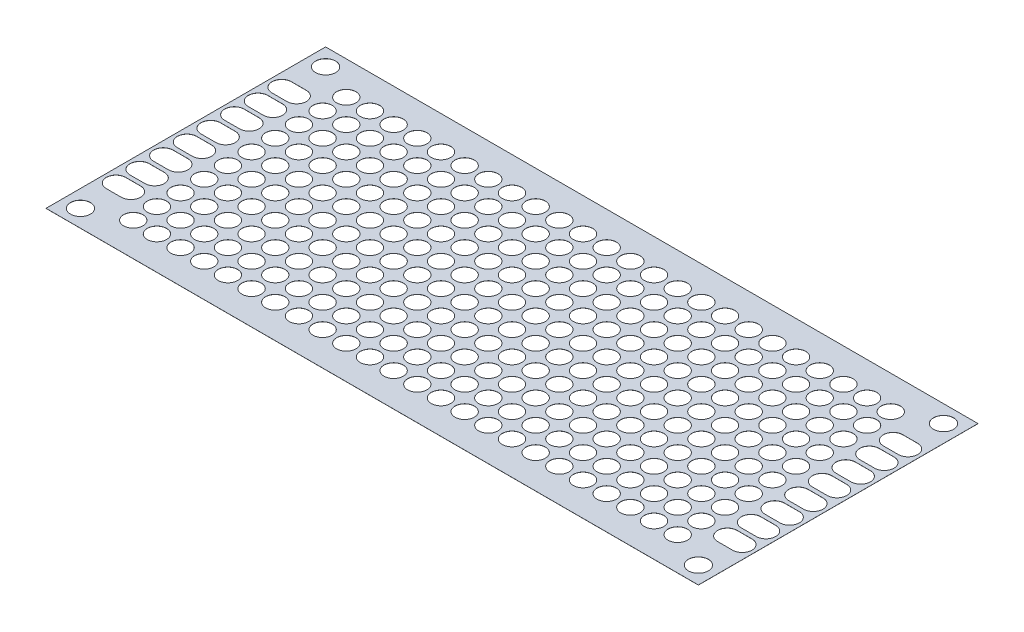
from build123d import *

# Parameters (mm, degrees)
SKETCH1_W           = 70
SKETCH1_H           = 30
BOSS_EXTRUDE1_DEPTH = 0.01
SKETCH2_R           = 1.0375
SKETCH2_R_2         = 1.074207477
CUT_EXTRUDE1_DEPTH  = 39.078866842


with BuildPart() as part:
    # Sketch1 → Boss-Extrude1 (new body)
    with BuildSketch(Plane(origin=(0, 0, 0), x_dir=(1, 0, 0), z_dir=(0, 1, 0))):
        Rectangle(SKETCH1_W, SKETCH1_H)
    extrude(amount=BOSS_EXTRUDE1_DEPTH)

    # Sketch2 → Cut-Extrude1 (cut, through all)
    with BuildSketch(Plane(origin=(0, 0.01, 0), x_dir=(1, 0, 0), z_dir=(0, 1, 0))):
        with Locations((-29.21, -11.43)):
            Circle(SKETCH2_R)
        with Locations((-26.67, -11.43)):
            Circle(SKETCH2_R)
        with Locations((-24.13, -11.43)):
            Circle(SKETCH2_R)
        with Locations((-21.59, -11.43)):
            Circle(SKETCH2_R)
        with Locations((-19.05, -11.43)):
            Circle(SKETCH2_R)
        with Locations((-16.51, -11.43)):
            Circle(SKETCH2_R)
        with Locations((-13.97, -11.43)):
            Circle(SKETCH2_R)
        with Locations((-11.43, -11.43)):
            Circle(SKETCH2_R)
        with Locations((-8.89, -11.43)):
            Circle(SKETCH2_R)
        with Locations((-6.35, -11.43)):
            Circle(SKETCH2_R)
        with Locations((-3.81, -11.43)):
            Circle(SKETCH2_R)
        with Locations((-1.27, -11.43)):
            Circle(SKETCH2_R)
        with Locations((1.27, -11.43)):
            Circle(SKETCH2_R)
        with Locations((3.81, -11.43)):
            Circle(SKETCH2_R)
        with Locations((6.35, -11.43)):
            Circle(SKETCH2_R)
        with Locations((8.89, -11.43)):
            Circle(SKETCH2_R)
        with Locations((11.43, -11.43)):
            Circle(SKETCH2_R)
        with Locations((13.97, -11.43)):
            Circle(SKETCH2_R)
        with Locations((16.51, -11.43)):
            Circle(SKETCH2_R)
        with Locations((19.05, -11.43)):
            Circle(SKETCH2_R)
        with Locations((21.59, -11.43)):
            Circle(SKETCH2_R)
        with Locations((24.13, -11.43)):
            Circle(SKETCH2_R)
        with Locations((26.67, -11.43)):
            Circle(SKETCH2_R)
        with Locations((29.21, -11.43)):
            Circle(SKETCH2_R)
        with Locations((-29.21, -8.89)):
            Circle(SKETCH2_R)
        with Locations((-26.67, -8.89)):
            Circle(SKETCH2_R)
        with Locations((-24.13, -8.89)):
            Circle(SKETCH2_R)
        with Locations((-21.59, -8.89)):
            Circle(SKETCH2_R)
        with Locations((-19.05, -8.89)):
            Circle(SKETCH2_R)
        with Locations((-16.51, -8.89)):
            Circle(SKETCH2_R)
        with Locations((-13.97, -8.89)):
            Circle(SKETCH2_R)
        with Locations((-11.43, -8.89)):
            Circle(SKETCH2_R)
        with Locations((-8.89, -8.89)):
            Circle(SKETCH2_R)
        with Locations((-6.35, -8.89)):
            Circle(SKETCH2_R)
        with Locations((-3.81, -8.89)):
            Circle(SKETCH2_R)
        with Locations((-1.27, -8.89)):
            Circle(SKETCH2_R)
        with Locations((1.27, -8.89)):
            Circle(SKETCH2_R)
        with Locations((3.81, -8.89)):
            Circle(SKETCH2_R)
        with Locations((6.35, -8.89)):
            Circle(SKETCH2_R)
        with Locations((8.89, -8.89)):
            Circle(SKETCH2_R)
        with Locations((11.43, -8.89)):
            Circle(SKETCH2_R)
        with Locations((13.97, -8.89)):
            Circle(SKETCH2_R)
        with Locations((16.51, -8.89)):
            Circle(SKETCH2_R)
        with Locations((19.05, -8.89)):
            Circle(SKETCH2_R)
        with Locations((21.59, -8.89)):
            Circle(SKETCH2_R)
        with Locations((24.13, -8.89)):
            Circle(SKETCH2_R)
        with Locations((26.67, -8.89)):
            Circle(SKETCH2_R)
        with Locations((29.21, -8.89)):
            Circle(SKETCH2_R)
        with Locations((-29.21, -6.35)):
            Circle(SKETCH2_R)
        with Locations((-26.67, -6.35)):
            Circle(SKETCH2_R)
        with Locations((-24.13, -6.35)):
            Circle(SKETCH2_R)
        with Locations((-21.59, -6.35)):
            Circle(SKETCH2_R)
        with Locations((-19.05, -6.35)):
            Circle(SKETCH2_R)
        with Locations((-16.51, -6.35)):
            Circle(SKETCH2_R)
        with Locations((-13.97, -6.35)):
            Circle(SKETCH2_R)
        with Locations((-11.43, -6.35)):
            Circle(SKETCH2_R)
        with Locations((-8.89, -6.35)):
            Circle(SKETCH2_R)
        with Locations((-6.35, -6.35)):
            Circle(SKETCH2_R)
        with Locations((-3.81, -6.35)):
            Circle(SKETCH2_R)
        with Locations((-1.27, -6.35)):
            Circle(SKETCH2_R)
        with Locations((1.27, -6.35)):
            Circle(SKETCH2_R)
        with Locations((3.81, -6.35)):
            Circle(SKETCH2_R)
        with Locations((6.35, -6.35)):
            Circle(SKETCH2_R)
        with Locations((8.89, -6.35)):
            Circle(SKETCH2_R)
        with Locations((11.43, -6.35)):
            Circle(SKETCH2_R)
        with Locations((13.97, -6.35)):
            Circle(SKETCH2_R)
        with Locations((16.51, -6.35)):
            Circle(SKETCH2_R)
        with Locations((19.05, -6.35)):
            Circle(SKETCH2_R)
        with Locations((21.59, -6.35)):
            Circle(SKETCH2_R)
        with Locations((24.13, -6.35)):
            Circle(SKETCH2_R)
        with Locations((26.67, -6.35)):
            Circle(SKETCH2_R)
        with Locations((29.21, -6.35)):
            Circle(SKETCH2_R)
        with Locations((-29.21, -3.81)):
            Circle(SKETCH2_R)
        with Locations((-26.67, -3.81)):
            Circle(SKETCH2_R)
        with Locations((-24.13, -3.81)):
            Circle(SKETCH2_R)
        with Locations((-21.59, -3.81)):
            Circle(SKETCH2_R)
        with Locations((-19.05, -3.81)):
            Circle(SKETCH2_R)
        with Locations((-16.51, -3.81)):
            Circle(SKETCH2_R)
        with Locations((-13.97, -3.81)):
            Circle(SKETCH2_R)
        with Locations((-11.43, -3.81)):
            Circle(SKETCH2_R)
        with Locations((-8.89, -3.81)):
            Circle(SKETCH2_R)
        with Locations((-6.35, -3.81)):
            Circle(SKETCH2_R)
        with Locations((-3.81, -3.81)):
            Circle(SKETCH2_R)
        with Locations((-1.27, -3.81)):
            Circle(SKETCH2_R)
        with Locations((1.27, -3.81)):
            Circle(SKETCH2_R)
        with Locations((3.81, -3.81)):
            Circle(SKETCH2_R)
        with Locations((6.35, -3.81)):
            Circle(SKETCH2_R)
        with Locations((8.89, -3.81)):
            Circle(SKETCH2_R)
        with Locations((11.43, -3.81)):
            Circle(SKETCH2_R)
        with Locations((13.97, -3.81)):
            Circle(SKETCH2_R)
        with Locations((16.51, -3.81)):
            Circle(SKETCH2_R)
        with Locations((19.05, -3.81)):
            Circle(SKETCH2_R)
        with Locations((21.59, -3.81)):
            Circle(SKETCH2_R)
        with Locations((24.13, -3.81)):
            Circle(SKETCH2_R)
        with Locations((26.67, -3.81)):
            Circle(SKETCH2_R)
        with Locations((29.21, -3.81)):
            Circle(SKETCH2_R)
        with Locations((-29.21, -1.27)):
            Circle(SKETCH2_R)
        with Locations((-26.67, -1.27)):
            Circle(SKETCH2_R)
        with Locations((-24.13, -1.27)):
            Circle(SKETCH2_R)
        with Locations((-21.59, -1.27)):
            Circle(SKETCH2_R)
        with Locations((-19.05, -1.27)):
            Circle(SKETCH2_R)
        with Locations((-16.51, -1.27)):
            Circle(SKETCH2_R)
        with Locations((-13.97, -1.27)):
            Circle(SKETCH2_R)
        with Locations((-11.43, -1.27)):
            Circle(SKETCH2_R)
        with Locations((-8.89, -1.27)):
            Circle(SKETCH2_R)
        with Locations((-6.35, -1.27)):
            Circle(SKETCH2_R)
        with Locations((-3.81, -1.27)):
            Circle(SKETCH2_R)
        with Locations((-1.27, -1.27)):
            Circle(SKETCH2_R)
        with Locations((1.27, -1.27)):
            Circle(SKETCH2_R)
        with Locations((3.81, -1.27)):
            Circle(SKETCH2_R)
        with Locations((6.35, -1.27)):
            Circle(SKETCH2_R)
        with Locations((8.89, -1.27)):
            Circle(SKETCH2_R)
        with Locations((11.43, -1.27)):
            Circle(SKETCH2_R)
        with Locations((13.97, -1.27)):
            Circle(SKETCH2_R)
        with Locations((16.51, -1.27)):
            Circle(SKETCH2_R)
        with Locations((19.05, -1.27)):
            Circle(SKETCH2_R)
        with Locations((21.59, -1.27)):
            Circle(SKETCH2_R)
        with Locations((24.13, -1.27)):
            Circle(SKETCH2_R)
        with Locations((26.67, -1.27)):
            Circle(SKETCH2_R)
        with Locations((29.21, -1.27)):
            Circle(SKETCH2_R)
        with Locations((-29.21, 1.27)):
            Circle(SKETCH2_R)
        with Locations((-26.67, 1.27)):
            Circle(SKETCH2_R)
        with Locations((-24.13, 1.27)):
            Circle(SKETCH2_R)
        with Locations((-21.59, 1.27)):
            Circle(SKETCH2_R)
        with Locations((-19.05, 1.27)):
            Circle(SKETCH2_R)
        with Locations((-16.51, 1.27)):
            Circle(SKETCH2_R)
        with Locations((-13.97, 1.27)):
            Circle(SKETCH2_R)
        with Locations((-11.43, 1.27)):
            Circle(SKETCH2_R)
        with Locations((-8.89, 1.27)):
            Circle(SKETCH2_R)
        with Locations((-6.35, 1.27)):
            Circle(SKETCH2_R)
        with Locations((-3.81, 1.27)):
            Circle(SKETCH2_R)
        with Locations((-1.27, 1.27)):
            Circle(SKETCH2_R)
        with Locations((1.27, 1.27)):
            Circle(SKETCH2_R)
        with Locations((3.81, 1.27)):
            Circle(SKETCH2_R)
        with Locations((6.35, 1.27)):
            Circle(SKETCH2_R)
        with Locations((8.89, 1.27)):
            Circle(SKETCH2_R)
        with Locations((11.43, 1.27)):
            Circle(SKETCH2_R)
        with Locations((13.97, 1.27)):
            Circle(SKETCH2_R)
        with Locations((16.51, 1.27)):
            Circle(SKETCH2_R)
        with Locations((19.05, 1.27)):
            Circle(SKETCH2_R)
        with Locations((21.59, 1.27)):
            Circle(SKETCH2_R)
        with Locations((24.13, 1.27)):
            Circle(SKETCH2_R)
        with Locations((26.67, 1.27)):
            Circle(SKETCH2_R)
        with Locations((29.21, 1.27)):
            Circle(SKETCH2_R)
        with Locations((-29.21, 3.81)):
            Circle(SKETCH2_R)
        with Locations((-26.67, 3.81)):
            Circle(SKETCH2_R)
        with Locations((-24.13, 3.81)):
            Circle(SKETCH2_R)
        with Locations((-21.59, 3.81)):
            Circle(SKETCH2_R)
        with Locations((-19.05, 3.81)):
            Circle(SKETCH2_R)
        with Locations((-16.51, 3.81)):
            Circle(SKETCH2_R)
        with Locations((-13.97, 3.81)):
            Circle(SKETCH2_R)
        with Locations((-11.43, 3.81)):
            Circle(SKETCH2_R)
        with Locations((-8.89, 3.81)):
            Circle(SKETCH2_R)
        with Locations((-6.35, 3.81)):
            Circle(SKETCH2_R)
        with Locations((-3.81, 3.81)):
            Circle(SKETCH2_R)
        with Locations((-1.27, 3.81)):
            Circle(SKETCH2_R)
        with Locations((1.27, 3.81)):
            Circle(SKETCH2_R)
        with Locations((3.81, 3.81)):
            Circle(SKETCH2_R)
        with Locations((6.35, 3.81)):
            Circle(SKETCH2_R)
        with Locations((8.89, 3.81)):
            Circle(SKETCH2_R)
        with Locations((11.43, 3.81)):
            Circle(SKETCH2_R)
        with Locations((13.97, 3.81)):
            Circle(SKETCH2_R)
        with Locations((16.51, 3.81)):
            Circle(SKETCH2_R)
        with Locations((19.05, 3.81)):
            Circle(SKETCH2_R)
        with Locations((21.59, 3.81)):
            Circle(SKETCH2_R)
        with Locations((24.13, 3.81)):
            Circle(SKETCH2_R)
        with Locations((26.67, 3.81)):
            Circle(SKETCH2_R)
        with Locations((29.21, 3.81)):
            Circle(SKETCH2_R)
        with Locations((-29.21, 6.35)):
            Circle(SKETCH2_R)
        with Locations((-26.67, 6.35)):
            Circle(SKETCH2_R)
        with Locations((-24.13, 6.35)):
            Circle(SKETCH2_R)
        with Locations((-21.59, 6.35)):
            Circle(SKETCH2_R)
        with Locations((-19.05, 6.35)):
            Circle(SKETCH2_R)
        with Locations((-16.51, 6.35)):
            Circle(SKETCH2_R)
        with Locations((-13.97, 6.35)):
            Circle(SKETCH2_R)
        with Locations((-11.43, 6.35)):
            Circle(SKETCH2_R)
        with Locations((-8.89, 6.35)):
            Circle(SKETCH2_R)
        with Locations((-6.35, 6.35)):
            Circle(SKETCH2_R)
        with Locations((-3.81, 6.35)):
            Circle(SKETCH2_R)
        with Locations((-1.27, 6.35)):
            Circle(SKETCH2_R)
        with Locations((1.27, 6.35)):
            Circle(SKETCH2_R)
        with Locations((3.81, 6.35)):
            Circle(SKETCH2_R)
        with Locations((6.35, 6.35)):
            Circle(SKETCH2_R)
        with Locations((8.89, 6.35)):
            Circle(SKETCH2_R)
        with Locations((11.43, 6.35)):
            Circle(SKETCH2_R)
        with Locations((13.97, 6.35)):
            Circle(SKETCH2_R)
        with Locations((16.51, 6.35)):
            Circle(SKETCH2_R)
        with Locations((19.05, 6.35)):
            Circle(SKETCH2_R)
        with Locations((21.59, 6.35)):
            Circle(SKETCH2_R)
        with Locations((24.13, 6.35)):
            Circle(SKETCH2_R)
        with Locations((26.67, 6.35)):
            Circle(SKETCH2_R)
        with Locations((29.21, 6.35)):
            Circle(SKETCH2_R)
        with Locations((-29.21, 8.89)):
            Circle(SKETCH2_R)
        with Locations((-26.67, 8.89)):
            Circle(SKETCH2_R)
        with Locations((-24.13, 8.89)):
            Circle(SKETCH2_R)
        with Locations((-21.59, 8.89)):
            Circle(SKETCH2_R)
        with Locations((-19.05, 8.89)):
            Circle(SKETCH2_R)
        with Locations((-16.51, 8.89)):
            Circle(SKETCH2_R)
        with Locations((-13.97, 8.89)):
            Circle(SKETCH2_R)
        with Locations((-11.43, 8.89)):
            Circle(SKETCH2_R)
        with Locations((-8.89, 8.89)):
            Circle(SKETCH2_R)
        with Locations((-6.35, 8.89)):
            Circle(SKETCH2_R)
        with Locations((-3.81, 8.89)):
            Circle(SKETCH2_R)
        with Locations((-1.27, 8.89)):
            Circle(SKETCH2_R)
        with Locations((1.27, 8.89)):
            Circle(SKETCH2_R)
        with Locations((3.81, 8.89)):
            Circle(SKETCH2_R)
        with Locations((6.35, 8.89)):
            Circle(SKETCH2_R)
        with Locations((8.89, 8.89)):
            Circle(SKETCH2_R)
        with Locations((11.43, 8.89)):
            Circle(SKETCH2_R)
        with Locations((13.97, 8.89)):
            Circle(SKETCH2_R)
        with Locations((16.51, 8.89)):
            Circle(SKETCH2_R)
        with Locations((19.05, 8.89)):
            Circle(SKETCH2_R)
        with Locations((21.59, 8.89)):
            Circle(SKETCH2_R)
        with Locations((24.13, 8.89)):
            Circle(SKETCH2_R)
        with Locations((26.67, 8.89)):
            Circle(SKETCH2_R)
        with Locations((29.21, 8.89)):
            Circle(SKETCH2_R)
        with Locations((-29.21, 11.43)):
            Circle(SKETCH2_R)
        with Locations((-26.67, 11.43)):
            Circle(SKETCH2_R)
        with Locations((-24.13, 11.43)):
            Circle(SKETCH2_R)
        with Locations((-21.59, 11.43)):
            Circle(SKETCH2_R)
        with Locations((-19.05, 11.43)):
            Circle(SKETCH2_R)
        with Locations((-16.51, 11.43)):
            Circle(SKETCH2_R)
        with Locations((-13.97, 11.43)):
            Circle(SKETCH2_R)
        with Locations((-11.43, 11.43)):
            Circle(SKETCH2_R)
        with Locations((-8.89, 11.43)):
            Circle(SKETCH2_R)
        with Locations((-6.35, 11.43)):
            Circle(SKETCH2_R)
        with Locations((-3.81, 11.43)):
            Circle(SKETCH2_R)
        with Locations((-1.27, 11.43)):
            Circle(SKETCH2_R)
        with Locations((1.27, 11.43)):
            Circle(SKETCH2_R)
        with Locations((3.81, 11.43)):
            Circle(SKETCH2_R)
        with Locations((6.35, 11.43)):
            Circle(SKETCH2_R)
        with Locations((8.89, 11.43)):
            Circle(SKETCH2_R)
        with Locations((11.43, 11.43)):
            Circle(SKETCH2_R)
        with Locations((13.97, 11.43)):
            Circle(SKETCH2_R)
        with Locations((16.51, 11.43)):
            Circle(SKETCH2_R)
        with Locations((19.05, 11.43)):
            Circle(SKETCH2_R)
        with Locations((21.59, 11.43)):
            Circle(SKETCH2_R)
        with Locations((24.13, 11.43)):
            Circle(SKETCH2_R)
        with Locations((26.67, 11.43)):
            Circle(SKETCH2_R)
        with Locations((29.21, 11.43)):
            Circle(SKETCH2_R)
        with Locations((-33.15, -13.15)):
            Circle(SKETCH2_R_2)
        with Locations((-33.15, 13.15)):
            Circle(SKETCH2_R_2)
        with Locations((33.15, 13.15)):
            Circle(SKETCH2_R_2)
        with Locations((33.15, -13.15)):
            Circle(SKETCH2_R_2)
        with BuildLine():
            Line((-33.6, -7.847659475), (-32, -7.847659475))
            ThreePointArc((-32, -7.847659475), (-30.957659475, -8.89), (-32, -9.932340525))
            Line((-32, -9.932340525), (-33.6, -9.932340525))
            ThreePointArc((-33.6, -9.932340525), (-34.642340525, -8.89), (-33.6, -7.847659475))
        make_face()
        with BuildLine():
            Line((-33.6, -5.307659475), (-32, -5.307659475))
            ThreePointArc((-32, -5.307659475), (-30.957659475, -6.35), (-32, -7.392340525))
            Line((-32, -7.392340525), (-33.6, -7.392340525))
            ThreePointArc((-33.6, -7.392340525), (-34.642340525, -6.35), (-33.6, -5.307659475))
        make_face()
        with BuildLine():
            Line((-33.6, -2.767659475), (-32, -2.767659475))
            ThreePointArc((-32, -2.767659475), (-30.957659475, -3.81), (-32, -4.852340525))
            Line((-32, -4.852340525), (-33.6, -4.852340525))
            ThreePointArc((-33.6, -4.852340525), (-34.642340525, -3.81), (-33.6, -2.767659475))
        make_face()
        with BuildLine():
            Line((-33.6, -0.227659475), (-32, -0.227659475))
            ThreePointArc((-32, -0.227659475), (-30.957659475, -1.27), (-32, -2.312340525))
            Line((-32, -2.312340525), (-33.6, -2.312340525))
            ThreePointArc((-33.6, -2.312340525), (-34.642340525, -1.27), (-33.6, -0.227659475))
        make_face()
        with BuildLine():
            Line((-33.6, 7.847659475), (-32, 7.847659475))
            ThreePointArc((-32, 7.847659475), (-30.957659475, 8.89), (-32, 9.932340525))
            Line((-32, 9.932340525), (-33.6, 9.932340525))
            ThreePointArc((-33.6, 9.932340525), (-34.642340525, 8.89), (-33.6, 7.847659475))
        make_face()
        with BuildLine():
            Line((-33.6, 5.307659475), (-32, 5.307659475))
            ThreePointArc((-32, 5.307659475), (-30.957659475, 6.35), (-32, 7.392340525))
            Line((-32, 7.392340525), (-33.6, 7.392340525))
            ThreePointArc((-33.6, 7.392340525), (-34.642340525, 6.35), (-33.6, 5.307659475))
        make_face()
        with BuildLine():
            Line((-33.6, 2.767659475), (-32, 2.767659475))
            ThreePointArc((-32, 2.767659475), (-30.957659475, 3.81), (-32, 4.852340525))
            Line((-32, 4.852340525), (-33.6, 4.852340525))
            ThreePointArc((-33.6, 4.852340525), (-34.642340525, 3.81), (-33.6, 2.767659475))
        make_face()
        with BuildLine():
            Line((-33.6, 0.227659475), (-32, 0.227659475))
            ThreePointArc((-32, 0.227659475), (-30.957659475, 1.27), (-32, 2.312340525))
            Line((-32, 2.312340525), (-33.6, 2.312340525))
            ThreePointArc((-33.6, 2.312340525), (-34.642340525, 1.27), (-33.6, 0.227659475))
        make_face()
        with BuildLine():
            Line((33.6, -7.847659475), (32, -7.847659475))
            ThreePointArc((32, -7.847659475), (30.957659475, -8.89), (32, -9.932340525))
            Line((32, -9.932340525), (33.6, -9.932340525))
            ThreePointArc((33.6, -9.932340525), (34.642340525, -8.89), (33.6, -7.847659475))
        make_face()
        with BuildLine():
            Line((33.6, -5.307659475), (32, -5.307659475))
            ThreePointArc((32, -5.307659475), (30.957659475, -6.35), (32, -7.392340525))
            Line((32, -7.392340525), (33.6, -7.392340525))
            ThreePointArc((33.6, -7.392340525), (34.642340525, -6.35), (33.6, -5.307659475))
        make_face()
        with BuildLine():
            Line((33.6, -2.767659475), (32, -2.767659475))
            ThreePointArc((32, -2.767659475), (30.957659475, -3.81), (32, -4.852340525))
            Line((32, -4.852340525), (33.6, -4.852340525))
            ThreePointArc((33.6, -4.852340525), (34.642340525, -3.81), (33.6, -2.767659475))
        make_face()
        with BuildLine():
            Line((33.6, -0.227659475), (32, -0.227659475))
            ThreePointArc((32, -0.227659475), (30.957659475, -1.27), (32, -2.312340525))
            Line((32, -2.312340525), (33.6, -2.312340525))
            ThreePointArc((33.6, -2.312340525), (34.642340525, -1.27), (33.6, -0.227659475))
        make_face()
        with BuildLine():
            Line((33.6, 7.847659475), (32, 7.847659475))
            ThreePointArc((32, 7.847659475), (30.957659475, 8.89), (32, 9.932340525))
            Line((32, 9.932340525), (33.6, 9.932340525))
            ThreePointArc((33.6, 9.932340525), (34.642340525, 8.89), (33.6, 7.847659475))
        make_face()
        with BuildLine():
            Line((33.6, 5.307659475), (32, 5.307659475))
            ThreePointArc((32, 5.307659475), (30.957659475, 6.35), (32, 7.392340525))
            Line((32, 7.392340525), (33.6, 7.392340525))
            ThreePointArc((33.6, 7.392340525), (34.642340525, 6.35), (33.6, 5.307659475))
        make_face()
        with BuildLine():
            Line((33.6, 2.767659475), (32, 2.767659475))
            ThreePointArc((32, 2.767659475), (30.957659475, 3.81), (32, 4.852340525))
            Line((32, 4.852340525), (33.6, 4.852340525))
            ThreePointArc((33.6, 4.852340525), (34.642340525, 3.81), (33.6, 2.767659475))
        make_face()
        with BuildLine():
            Line((33.6, 0.227659475), (32, 0.227659475))
            ThreePointArc((32, 0.227659475), (30.957659475, 1.27), (32, 2.312340525))
            Line((32, 2.312340525), (33.6, 2.312340525))
            ThreePointArc((33.6, 2.312340525), (34.642340525, 1.27), (33.6, 0.227659475))
        make_face()
    extrude(amount=-CUT_EXTRUDE1_DEPTH, mode=Mode.SUBTRACT)


solid = part.part
